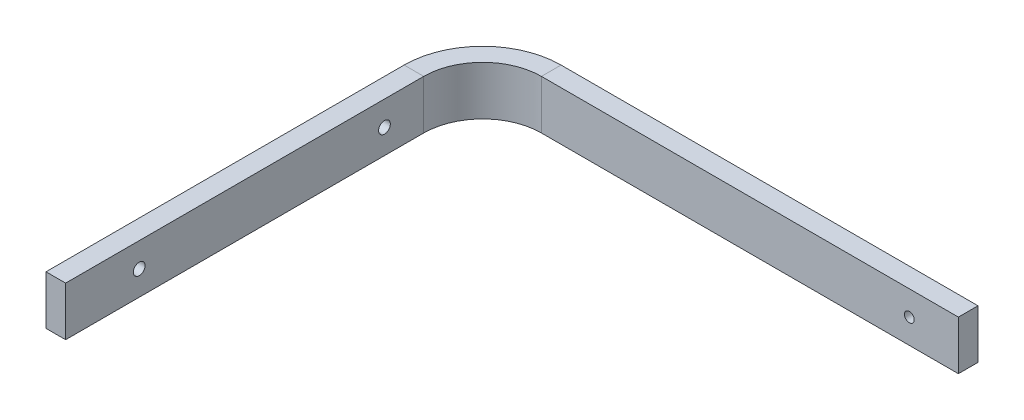
from build123d import *

# Parameters (mm, degrees)
ESQUISSE1_W             = 450
ESQUISSE1_H             = 25
EXTRUSION1_DEPTH        = 10
PLIAGE_START            = -12.5
PLIAGE_1_DEPTH          = 25
PLIAGE_1_2_DEPTH        = 25
ESQUISSE5_R             = 3
ENL_V_MAT_EXTRU_1_DEPTH = 330.361564282
ESQUISSE7_R             = 2.5
ENL_V_MAT_EXTRU_2_DEPTH = 331.27116136


# Read off the part's stored shape, not the designer's step: Pliage 1
with BuildPart() as part:
    # Esquisse1 → Extrusion1 (new body)
    with BuildSketch(Plane.XY):
        with Locations((-225, 0)):
            Rectangle(ESQUISSE1_W, ESQUISSE1_H)
    extrude(amount=EXTRUSION1_DEPTH)

    # Pliage 1 outline → Pliage 1 (cut)
    with BuildSketch(Plane(origin=(0, 0, 0), x_dir=(1, 0, 0), z_dir=(0, 1, 0)).offset(PLIAGE_START)):
        with BuildLine():
            Line((-450, -10), (-238.968577392, -10))
            ThreePointArc((-238.968577392, -10), (-226.653199905, -2.583426132), (-212.511064281, 0))
            Line((-212.511064281, 0), (-450, 0))
            Line((-450, 0), (-450, -10))
        make_face()
    extrude(amount=PLIAGE_1_DEPTH, mode=Mode.SUBTRACT)

    # Pliage 1 2 outline → Pliage 1 2 (add)
    with BuildSketch(Plane(origin=(0, 0, 0), x_dir=(1, 0, 0), z_dir=(0, 1, 0)).offset(PLIAGE_START)):
        with BuildLine():
            ThreePointArc((-238.968577392, -10), (-248.968577392, -23.542486889), (-252.511064281, -40))
            Line((-252.511064281, -40), (-252.511064281, -222.511064281))
            Line((-252.511064281, -222.511064281), (-242.511064281, -222.511064281))
            Line((-242.511064281, -222.511064281), (-242.511064281, -40))
            ThreePointArc((-242.511064281, -40), (-233.724267717, -18.786796564), (-212.511064281, -10))
            Line((-212.511064281, -10), (-238.968577392, -10))
        make_face()
    extrude(amount=PLIAGE_1_2_DEPTH)

    # Esquisse5 → Enlèv. mat.-Extru.1 (cut, through all)
    with BuildSketch(Plane(origin=(-242.511064281, 0, 0), x_dir=(0, 0, -1), z_dir=(1, 0, 0))):
        with Locations((-185, 0)):
            Circle(ESQUISSE5_R)
        with Locations((-60, 0)):
            Circle(ESQUISSE5_R)
    extrude(amount=-ENL_V_MAT_EXTRU_1_DEPTH, mode=Mode.SUBTRACT)

    # Esquisse7 → Enlèv. mat.-Extru.2 (cut, through all)
    with BuildSketch(Plane.XY.offset(10)):
        with Locations((-25, 0)):
            Circle(ESQUISSE7_R)
    extrude(amount=-ENL_V_MAT_EXTRU_2_DEPTH, mode=Mode.SUBTRACT)


solid = part.part
